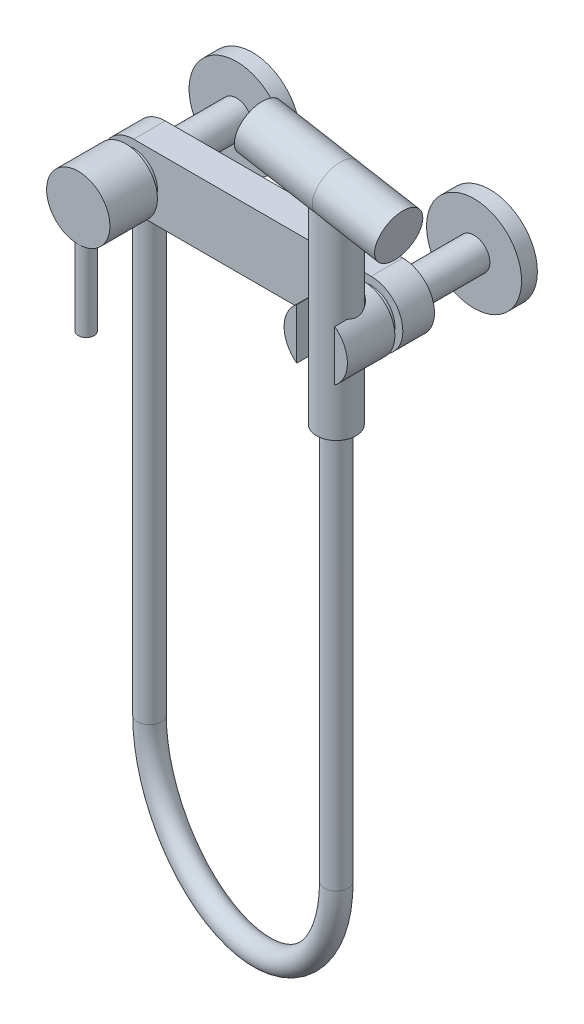
from build123d import *

# Parameters (mm, degrees)
SKETCH_1_R               = 30
EXTRUDE_1_DEPTH          = 10
EXTRUDE_1_2_DEPTH        = 10
SKETCH_2_R               = 10
EXTRUDE_2_DEPTH          = 45
EXTRUDE_3_DEPTH          = 20
SKETCH_4_R               = 15
EXTRUDE_4_DEPTH          = 5
SKETCH_5_R               = 20
EXTRUDE_5_DEPTH          = 30
SKETCH_6_R               = 5
EXTRUDE_6_DEPTH          = 70
CUT_EXTRUDE_1_DEPTH      = 223.26110779
CUT_EXTRUDE_1_DEPTH_BACK = 223.26110779
SKETCH_9_R               = 7.5
EXTRUDE_7_DEPTH          = 50
SWEEP_START              = -300.0000001
SWEEP_1_OUTLINE_R        = 7.5
SWEEP_1_DEPTH            = 300.0000001
SWEEP_1_2_OUTLINE_R      = 7.5
SWEEP_1_2_ANGLE          = 180
EXTRUDE_8_DEPTH          = 80
EXTRUDE_8_DEPTH_BACK     = 50
SKETCH_10_R              = 12.5
SWEEP_2_PROFILE_R        = 15


with BuildPart() as part:
    # Эскиз1 → Бобышка-Вытянуть1 (new body)
    with BuildSketch(Plane.XY):
        Circle(SKETCH_1_R)
    extrude(amount=EXTRUDE_1_DEPTH)



with BuildPart() as body_2:
    # Эскиз1 → Extrude 1 2 (new body)
    with BuildSketch(Plane.XY):
        with Locations((150, 0)):
            Circle(SKETCH_1_R)
    extrude(amount=EXTRUDE_1_2_DEPTH)


with BuildPart() as part_1:
    add(part.part)

    add(body_2.part)  # Бобышка-Вытянуть2 merges body 2
    # Эскиз2 → Бобышка-Вытянуть2 (add)
    with BuildSketch(Plane.XY.offset(10)):
        with Locations(Location((0, 0, 0), (0, 0, 180))):
            Circle(SKETCH_2_R)
        with Locations(Location((150, 0, 0), (0, 0, 180))):
            Circle(SKETCH_2_R)
    extrude(amount=EXTRUDE_2_DEPTH)

    # Эскиз3 → Бобышка-Вытянуть3 (add)
    with BuildSketch(Plane.XY.offset(55)):
        with BuildLine():
            Line((0, 20), (150, 20))
            ThreePointArc((150, 20), (170, 0), (150, -20))
            Line((150, -20), (0, -20))
            ThreePointArc((0, -20), (-20, 0), (0, 20))
        make_face()
    extrude(amount=EXTRUDE_3_DEPTH)

    # Эскиз4 → Бобышка-Вытянуть4 (add)
    with BuildSketch(Plane.XY.offset(75)):
        Circle(SKETCH_4_R)
        with Locations((150, 0)):
            Circle(SKETCH_4_R)
    extrude(amount=EXTRUDE_4_DEPTH)

    # Эскиз5 → Бобышка-Вытянуть5 (add)
    with BuildSketch(Plane.XY.offset(80)):
        Circle(SKETCH_5_R)
        with Locations((150, 0)):
            Circle(SKETCH_5_R)
    extrude(amount=EXTRUDE_5_DEPTH)

    # Эскиз6 → Бобышка-Вытянуть6 (add)
    with BuildSketch(Plane(origin=(0, 0, 0), x_dir=(1, 0, 0), z_dir=(0, 1, 0))):
        with Locations(Location((0, -105, 0), (0, 0, 270))):
            Circle(SKETCH_6_R)
    extrude(amount=-EXTRUDE_6_DEPTH)

    # Эскиз8 → Вырез-Вытянуть1 (cut, two sides: drawn at the far end of the back side and taken through both)
    with BuildSketch(Plane(origin=(0, 0, 0), x_dir=(1, 0, 0), z_dir=(0, 1, 0)).offset(-CUT_EXTRUDE_1_DEPTH_BACK)):
        with BuildLine():
            Line((138, -102), (138, -110))
            Line((138, -110), (162, -110))
            Line((162, -110), (162, -102))
            ThreePointArc((162, -102), (150, -84), (138, -102))
        make_face()
    extrude(amount=CUT_EXTRUDE_1_DEPTH + CUT_EXTRUDE_1_DEPTH_BACK, mode=Mode.SUBTRACT)

    # Эскиз9 → Бобышка-Вытянуть7 (add)
    with BuildSketch(Plane(origin=(0, 0, 0), x_dir=(1, 0, 0), z_dir=(0, 1, 0))):
        with Locations(Location((0, -65, 0), (0, 0, 270))):
            Circle(SKETCH_9_R)
    extrude(amount=-EXTRUDE_7_DEPTH)

    # По траектории1: read off the stored shape, not the designer's step
    # По траектории1 outline → По траектории1 (add)
    with BuildSketch(Plane(origin=(0, 0, 0), x_dir=(1, 0, 0), z_dir=(0, 1, 0)).offset(SWEEP_START)):
        with Locations((0, -65)):
            Circle(SWEEP_1_OUTLINE_R)
        with Locations((150, -97)):
            Circle(SWEEP_1_OUTLINE_R)
    extrude(amount=SWEEP_1_DEPTH)

    # Sweep 1 2 outline → Sweep 1 2 (revolve)
    with BuildSketch(Plane(origin=(88.263050502, -300, 18.829450774), x_dir=(0.9779928364243075, 0, 0.20863847177051914), z_dir=(0, 1, 0))):
        with Locations((76.68767828, -63.569534368)):
            Circle(SWEEP_1_2_OUTLINE_R)
    revolve(axis=Axis((88.263050502, -300, 18.829450774), (0.20863847177051914, 0, -0.9779928364243075)), revolution_arc=SWEEP_1_2_ANGLE)

    # Эскиз10 → Бобышка-Вытянуть8 (add, two sides: drawn at the far end of the back side and taken through both)
    with BuildSketch(Plane(origin=(0, 0, 0), x_dir=(1, 0, 0), z_dir=(0, 1, 0)).offset(-EXTRUDE_8_DEPTH_BACK)):
        with Locations(Location((150, -97, 0), (0, 0, 270))):
            Circle(SKETCH_10_R)
    extrude(amount=EXTRUDE_8_DEPTH + EXTRUDE_8_DEPTH_BACK)

    # По траектории2: sweep along a path in Эскиз11
    with BuildLine(Plane.XY.offset(97)) as sweep_2_path:
        Line((189.39231012, 73.054072893), (150, 80))
        Line((150, 80), (100.759612349, 88.682408883))
    # По траектории2 profile (on start of the path) → По траектории2 (sweep)
    with BuildSketch(Plane(origin=(189.39231012, 73.054072893, 97), x_dir=(-0.17364817766693041, -0.9848077530122081, 0), z_dir=(-0.9848077530122081, 0.17364817766693041, 0))):
        Circle(SWEEP_2_PROFILE_R)
    sweep(path=sweep_2_path.line)


solid = part_1.part
